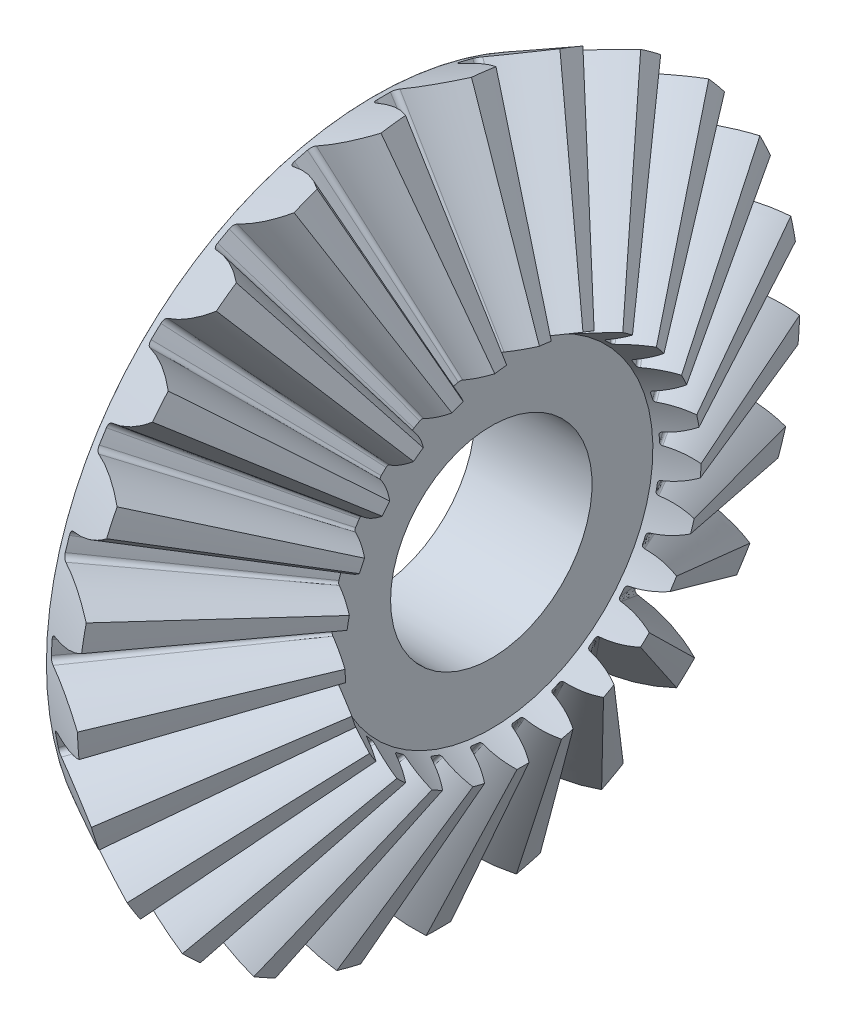
from build123d import *

# Parameters (mm, degrees)
TEETHCUTS_COUNT = 25
HUBSKE_R        = 8.134364449
HUB_DEPTH       = 0.0001016
BORSKE_R        = 2.5
BORE_DEPTH      = 5.733965321


with BuildPart() as part:
    # BasProSke → Base-Revolve (revolve)
    with BuildSketch(Plane(origin=(0, 0, 0), x_dir=(1, 0, 0), z_dir=(0, 1, 0)), mode=Mode.PRIVATE) as base_revolve_sk:
        Polygon((0, 0), (0, 8.134364451), (1.596531375, 8.964560763), (3.694106135, 4.419698517), (2.906985881, 4.010395986), (2.906985881, 0), align=None)
    revolve(base_revolve_sk.sketch.rotate(Axis((-10, 0, 0), (1, 0, 0)), 180), axis=Axis((-10, 0, 0), (1, 0, 0)))

    # ToothCut: read off the stored shape, not the designer's step
    # ToothCut: loft between two sections, ruled curve by curve
    toothcut_from = [
        Edge.make_bspline([(5.742437889, 0.004432151, -0.008306504), (5.73699223, 0.001600408, -0.015405296), (5.72869301, -0.002715186, -0.014653346), (5.724323348, -0.00498741, -0.006665238)], [0, 0, 0, 0, 1, 1, 1, 1], 3, [1, 0.727560025, 0.727560025, 1]),
        Edge.make_bspline([(5.724323348, -0.00498741, 0.006665238), (5.72869301, -0.002715186, 0.014653346), (5.73699223, 0.001600408, 0.015405296), (5.742437889, 0.004432151, 0.008306504)], [0, 0, 0, 0, 1, 1, 1, 1], 3, [1, 0.727560025, 0.727560025, 1]),
        Edge.make_bspline([(5.724323348, -0.00498741, -0.006665238), (5.723764339, -0.005278095, -0.005643322), (5.723338609, -0.005499474, -0.004542846), (5.723054648, -0.005647134, -0.003385753)], [0, 0, 0, 0, 1, 1, 1, 1], 3, [1, 0.993353597, 0.993353597, 1]),
        Edge.make_bspline([(5.723054648, -0.005647134, 0.003385753), (5.723338609, -0.005499474, 0.004542846), (5.723764339, -0.005278095, 0.005643322), (5.724323348, -0.00498741, 0.006665238)], [0, 0, 0, 0, 1, 1, 1, 1], 3, [1, 0.993353597, 0.993353597, 1]),
        Edge.make_bspline([(5.723054648, -0.005647134, -0.003385753), (5.722507566, -0.005931617, -0.001156488), (5.722507566, -0.005931617, 0.001156488), (5.723054648, -0.005647134, 0.003385753)], [0, 0, 0, 0, 1, 1, 1, 1], 3, [1, 0.975872478, 0.975872478, 1]),
        Edge.make_line((5.742437889, 0.004432151, 0.008306504), (5.742437889, 0.004432151, -0.008306504)),
    ]
    toothcut_to = [
        Edge.make_bspline([(1.719461216, 9.02848428, -0.926201664), (1.308313319, 8.814687375, -0.592597265), (0.838156917, 8.570206046, -0.37993452), (0.336462807, 8.30932511, -0.300639116)], [0, 0, 0, 0, 1, 1, 1, 1], 3, [1, 0.980523646, 0.980523646, 1]),
        Edge.make_bspline([(0.336462807, 8.30932511, 0.300639116), (0.838156917, 8.570206046, 0.37993452), (1.308313319, 8.814687375, 0.592597265), (1.719461216, 9.02848428, 0.926201664)], [0, 0, 0, 0, 1, 1, 1, 1], 3, [1, 0.980523646, 0.980523646, 1]),
        Edge.make_bspline([(0.336462807, 8.30932511, -0.300639116), (0.27442008, 8.277062892, -0.290832935), (0.233825503, 8.255953712, -0.237048227), (0.235182894, 8.256659555, -0.166450981)], [0, 0, 0, 0, 1, 1, 1, 1], 3, [1, 0.831637469, 0.831637469, 1]),
        Edge.make_bspline([(0.235182894, 8.256659555, 0.166450981), (0.233825503, 8.255953712, 0.237048227), (0.27442008, 8.277062892, 0.290832935), (0.336462807, 8.30932511, 0.300639116)], [0, 0, 0, 0, 1, 1, 1, 1], 3, [1, 0.831637469, 0.831637469, 1]),
        Edge.make_bspline([(0.235182894, 8.256659555, -0.166450981), (0.237316324, 8.257768939, -0.055492345), (0.237316324, 8.257768939, 0.055492345), (0.235182894, 8.256659555, 0.166450981)], [0, 0, 0, 0, 1, 1, 1, 1], 3, [1, 0.999843505, 0.999843505, 1]),
        Edge.make_line((1.719461216, 9.02848428, 0.926201664), (1.719461216, 9.02848428, -0.926201664)),
    ]
    toothcut = Solid(Shell([*[Face.make_surface_from_curves(toothcut_from[k], toothcut_to[k]) for k in range(6)], Face(Wire(toothcut_from)), Face(Wire(toothcut_to))]))
    add(toothcut, mode=Mode.SUBTRACT)

    # TeethCuts: ToothCut ×25 about axis
    teethcuts_axis = Axis((-10, 0, 0), (1, 0, 0))
    for i in range(1, TEETHCUTS_COUNT):
        add(toothcut.rotate(teethcuts_axis, i * 360 / TEETHCUTS_COUNT), mode=Mode.SUBTRACT)

    # HubSke → Hub (add)
    with BuildSketch(Plane.ZY):
        Circle(HUBSKE_R)
    extrude(amount=HUB_DEPTH)

    # BorSke → Bore (cut, symmetric)
    with BuildSketch(Plane(origin=(0, 0, 0), x_dir=(0, 0, -1), z_dir=(1, 0, 0))):
        with Locations(Location((0, 0, 0), (0, 0, 180))):
            Circle(BORSKE_R)
    extrude(amount=BORE_DEPTH, both=True, mode=Mode.SUBTRACT)


solid = part.part
